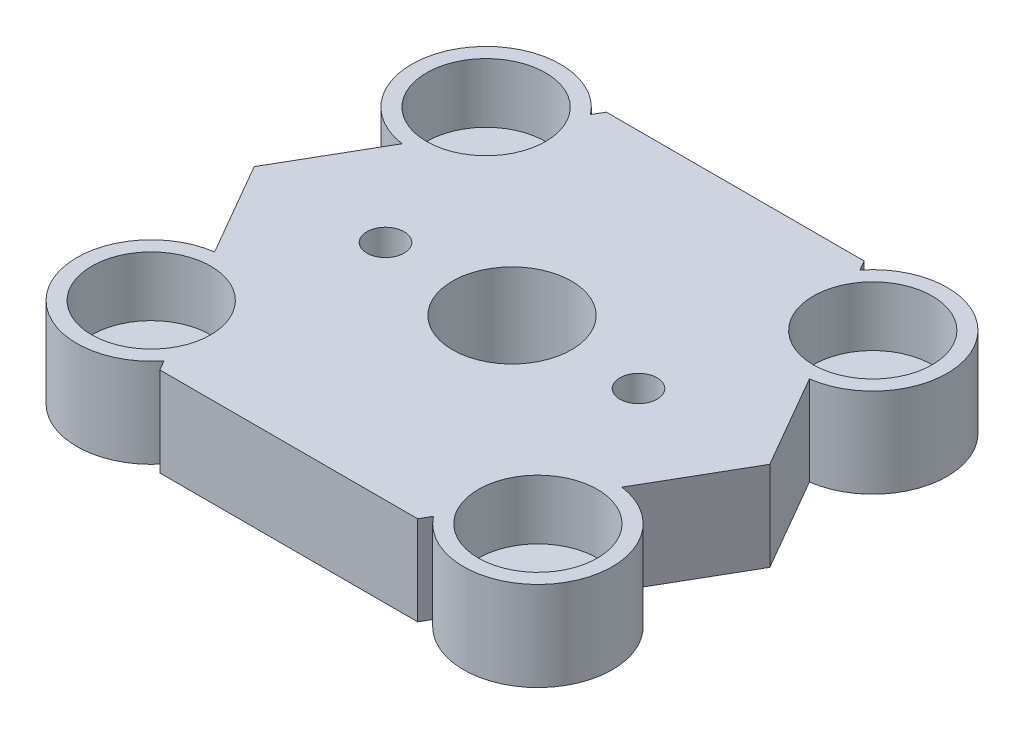
from build123d import *

# Parameters (mm, degrees)
SKETCH2_R           = 5
SKETCH2_R_2         = 1.5
SKETCH2_R_3         = 4
SKETCH2_R_4         = 1.25
BOSS_EXTRUDE1_DEPTH = 6
SKETCH3_R           = 3.5
CUT_EXTRUDE3_DEPTH  = 3
SKETCH4_R           = 4
CUT_EXTRUDE4_DEPTH  = 4


with BuildPart() as part:
    # Sketch2 → Boss-Extrude1 (new body)
    # profile 1 of 5: a face of its own
    with BuildSketch(Plane(origin=(0, 0, 0), x_dir=(1, 0, 0), z_dir=(0, 1, 0))):
        with Locations((-12.990381057, 11.25)):
            Circle(SKETCH2_R)
        with Locations((-12.990381057, 11.25)):
            Circle(SKETCH2_R_2, mode=Mode.SUBTRACT)
    # profile 2 of 5: a face of its own
    with BuildSketch(Plane(origin=(0, 0, 0), x_dir=(1, 0, 0), z_dir=(0, 1, 0))):
        with Locations((12.990381057, 11.25)):
            Circle(SKETCH2_R)
        with Locations((12.990381057, 11.25)):
            Circle(SKETCH2_R_2, mode=Mode.SUBTRACT)
    # profile 3 of 5: a face of its own
    with BuildSketch(Plane(origin=(0, 0, 0), x_dir=(1, 0, 0), z_dir=(0, 1, 0))):
        with Locations((12.990381057, -11.25)):
            Circle(SKETCH2_R)
        with Locations((12.990381057, -11.25)):
            Circle(SKETCH2_R_2, mode=Mode.SUBTRACT)
    # profile 4 of 5: a face of its own
    with BuildSketch(Plane(origin=(0, 0, 0), x_dir=(1, 0, 0), z_dir=(0, 1, 0))):
        with Locations((-12.990381057, -11.25)):
            Circle(SKETCH2_R)
        with Locations((-12.990381057, -11.25)):
            Circle(SKETCH2_R_2, mode=Mode.SUBTRACT)
    # profile 5 of 5: a face of its own
    with BuildSketch(Plane(origin=(0, 0, 0), x_dir=(1, 0, 0), z_dir=(0, 1, 0))):
        Polygon((17.320508076, 0), (8.660254038, 15), (-8.660254038, 15), (-17.320508076, 0), (-8.660254038, -15), (8.660254038, -15), align=None)
        Circle(SKETCH2_R_3, mode=Mode.SUBTRACT)
        with Locations((8.5, 0)):
            Circle(SKETCH2_R_4, mode=Mode.SUBTRACT)
        with Locations((-8.5, 0)):
            Circle(SKETCH2_R_4, mode=Mode.SUBTRACT)
    extrude(amount=BOSS_EXTRUDE1_DEPTH)

    # Sketch3 → Cut-Extrude3 (cut)
    with BuildSketch(Plane.XZ):
        with Locations((-8.5, 0)):
            Circle(SKETCH3_R)
        with Locations((8.5, 0)):
            Circle(SKETCH3_R)
    extrude(amount=-CUT_EXTRUDE3_DEPTH, mode=Mode.SUBTRACT)

    # Sketch4 → Cut-Extrude4 (cut)
    with BuildSketch(Plane(origin=(0, 6, 0), x_dir=(1, 0, 0), z_dir=(0, 1, 0))):
        with Locations((-12.990381057, 11.25)):
            Circle(SKETCH4_R)
        with Locations((12.990381057, 11.25)):
            Circle(SKETCH4_R)
        with Locations((-12.990381057, -11.25)):
            Circle(SKETCH4_R)
        with Locations((12.990381057, -11.25)):
            Circle(SKETCH4_R)
    extrude(amount=-CUT_EXTRUDE4_DEPTH, mode=Mode.SUBTRACT)


solid = part.part
